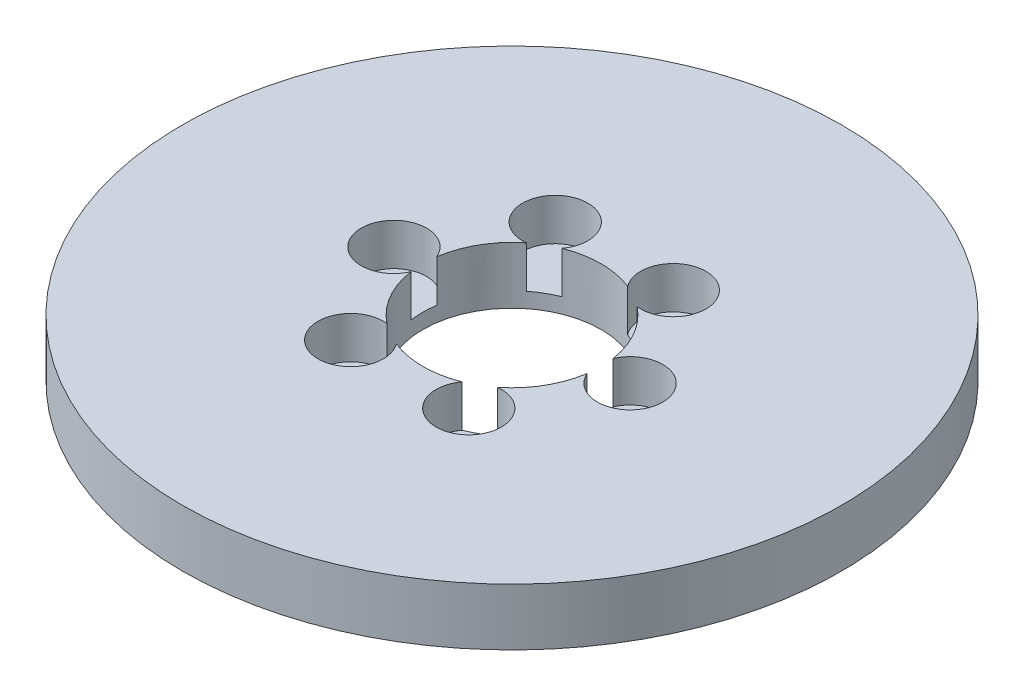
from build123d import *

# Parameters (mm, degrees)
SKETCH1_R           = 92.5
BOSS_EXTRUDE1_DEPTH = 16
SKETCH2_R           = 25
CUT_EXTRUDE1_DEPTH  = 132.789605053
SKETCH3_R           = 9.164583258
CUT_EXTRUDE2_DEPTH  = 11.763608752
CIRPATTERN1_COUNT   = 6


with BuildPart() as part:
    # Sketch1 → Boss-Extrude1 (new body)
    with BuildSketch(Plane(origin=(0, 0, 0), x_dir=(1, 0, 0), z_dir=(0, 1, 0))):
        Circle(SKETCH1_R)
    extrude(amount=BOSS_EXTRUDE1_DEPTH)

    # Sketch2 → Cut-Extrude1 (cut, through all)
    with BuildSketch(Plane(origin=(0, 0, 0), x_dir=(1, 0, 0), z_dir=(0, 1, 0))):
        Circle(SKETCH2_R)
    extrude(amount=CUT_EXTRUDE1_DEPTH, mode=Mode.SUBTRACT)

    # Sketch3 → Cut-Extrude2 (cut)
    with BuildSketch(Plane(origin=(0, 16, 0), x_dir=(1, 0, 0), z_dir=(0, 1, 0))):
        with Locations((-33.145226014, 0)):
            Circle(SKETCH3_R)
    cut_extrude2 = extrude(amount=-CUT_EXTRUDE2_DEPTH, mode=Mode.SUBTRACT)

    # CirPattern1: Cut-Extrude2 ×6 about axis
    cirpattern1_axis = Axis((0, 0, 0), (0, 1, 0))
    for i in range(1, CIRPATTERN1_COUNT):
        add(cut_extrude2.rotate(cirpattern1_axis, i * 360 / CIRPATTERN1_COUNT), mode=Mode.SUBTRACT)


solid = part.part
